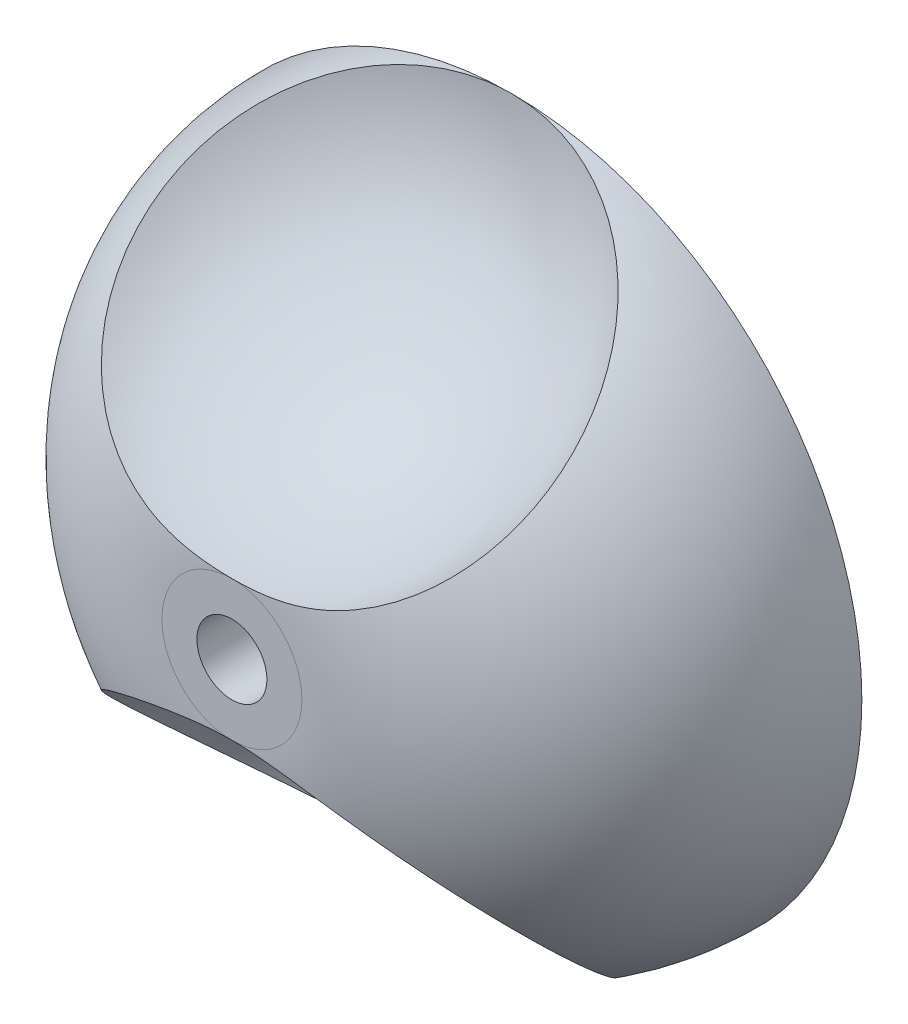
from build123d import *

# Parameters (mm, degrees)
SKETCH1_R           = 5
BOSS_EXTRUDE1_DEPTH = 4
FILLET1_R           = 4
SKETCH3_R           = 0.5
CUT_EXTRUDE1_DEPTH  = 9.124038577


with BuildPart() as part:
    # Sketch1 → Boss-Extrude1 (new body)
    with BuildSketch(Plane.XY):
        Circle(SKETCH1_R)
    extrude(amount=BOSS_EXTRUDE1_DEPTH)

    # Fillet1
    fillet1_edges = [part.edges().sort_by_distance(p)[0] for p in [
        (-5, 0, 4),
    ]]
    fillet(fillet1_edges, radius=FILLET1_R - 0.0001)  # a hair under: the kernel refuses the full size

    # Sketch2 → Cut-Revolve2 (revolve, cut)
    with BuildSketch(Plane(origin=(0, 0, 0), x_dir=(0, 0, -1), z_dir=(1, 0, 0))):
        with BuildLine():
            Line((0, 5), (-8, 5))
            ThreePointArc((-8, 5), (-4, 1), (0, 5))
        make_face()
    cut_revolve2 = revolve(axis=Axis((0, 5, 0), (0, 0, 1)), mode=Mode.SUBTRACT)

    # Mirror1: Cut-Revolve2 across plane
    add(cut_revolve2.mirror(Plane.ZX), mode=Mode.SUBTRACT)

    # Sketch3 → Cut-Extrude1 (cut, through all)
    with BuildSketch(Plane(origin=(0, 0, 0), x_dir=(-1, 0, 0), z_dir=(0, 0, -1))):
        Circle(SKETCH3_R)
    extrude(amount=-CUT_EXTRUDE1_DEPTH, mode=Mode.SUBTRACT)


solid = part.part
